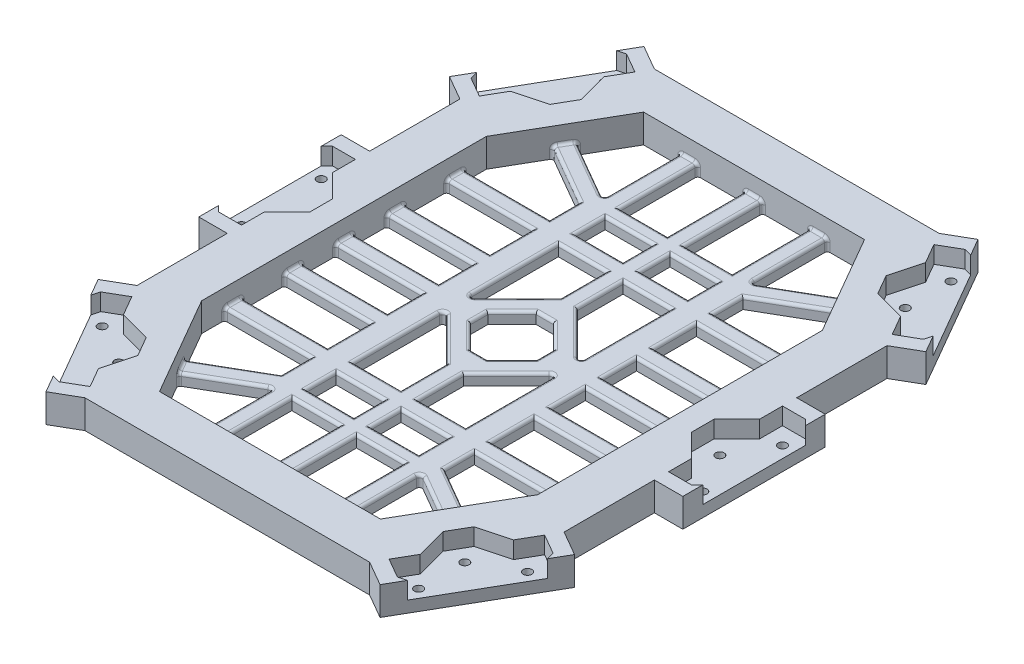
from build123d import *

# Parameters (mm, degrees)
EXTRUDE_1_DEPTH     = 10
SKETCH_2_W          = 20
SKETCH_2_H          = 50.000000000000014
SKETCH_2_W_2        = 20.000000000000014
SKETCH_2_H_2        = 49.999999999999986
EXTRUDE_2_DEPTH     = 10
CUT_EXTRUDE_1_DEPTH = 6
CUT_EXTRUDE_2_DEPTH = 6
CUT_EXTRUDE_3_DEPTH = 4
FILLET_1_R          = 1
SKETCH_6_R          = 1.4999999999999971
SKETCH_6_R_2        = 1.4999999999999973
SKETCH_6_R_3        = 1.5000000000000042
CUT_EXTRUDE_4_DEPTH = 136.2257371952552


with BuildPart() as part:
    # 草图1 → 凸台-拉伸1 (new body)
    with BuildSketch(Plane(origin=(0, 0, 0), x_dir=(1, 0, 0), z_dir=(0, 1, 0))):
        Polygon((-74.99999999999993, -56.6987298107775), (-49.999999999999915, -100), (50, -100.00000000000001), (75, -56.69872981077748), (75, 56.698729810777465), (49.99999999999999, 99.99999999999999), (-49.999999999999915, 99.99999999999999), (-74.99999999999991, 56.6987298107775), align=None)
    extrude(amount=EXTRUDE_1_DEPTH)

    # 草图2 → 凸台-拉伸2 (add)
    with BuildSketch(Plane(origin=(0, 10, 0), x_dir=(1, 0, 0), z_dir=(0, 1, 0))):
        with Locations((74.99999999999999, 1.78e-15)):
            Rectangle(SKETCH_2_W, SKETCH_2_H)
        Polygon((50.00000000000012, 99.99999999999976), (74.99999999999986, 56.698729810777685), (83.66025403784657, 61.698729810778985), (58.66025403784683, 105.00000000000107), align=None)
        Polygon((-74.99999999999983, 56.69872981077767), (-83.66025403784452, 61.69872981077777), (-58.660254037844794, 104.99999999999984), (-50.00000000000012, 99.99999999999974), align=None)
        Polygon((74.99999999999984, -56.69872981077769), (83.66025403784478, -61.69872981077793), (58.66025403784505, -105), (50.00000000000012, -99.99999999999976), align=None)
        Polygon((-74.99999999999983, -56.69872981077767), (-83.66025403784452, -61.69872981077777), (-58.660254037844794, -104.99999999999984), (-50.00000000000012, -99.99999999999974), align=None)
        with Locations((-74.99999999999997, -1.066e-14)):
            Rectangle(SKETCH_2_W_2, SKETCH_2_H_2)
    extrude(amount=-EXTRUDE_2_DEPTH)

    # 草图3 → 切除-拉伸1 (cut)
    with BuildSketch(Plane(origin=(0, 10, 0), x_dir=(1, 0, 0), z_dir=(0, 1, 0))):
        Polygon((67.00000000000001, 4), (67.00000000000001, 0), (67.00000000000001, -4), (75.00000000000001, -12), (75.00000000000001, -20), (83.00000000000001, -20), (88.00000000000003, -15), (88.00000000000003, 15), (83.00000000000001, 20), (75.00000000000001, 20), (75.00000000000001, 12), align=None)
        Polygon((-67.00000000000001, -4), (-74.99999999999999, -12), (-74.99999999999999, -20), (-82.99999999999999, -20), (-88, -15), (-88, 14.999999999999972), (-82.99999999999999, 19.99999999999997), (-74.99999999999999, 19.99999999999997), (-74.99999999999999, 11.999999999999973), (-67.00000000000001, 4), (-67.00000000000001, 0), align=None)
        Polygon((53.57179676972452, 77.81346652052642), (55.57179676972452, 74.34936490538865), (57.571796769724514, 70.88526329025092), (68.50000000000001, 67.95706005997543), (72.50000000000004, 61.02885682969991), (79.42820323027556, 65.02885682969992), (81.25833024919774, 71.85898384862213), (66.25833024919773, 97.83974596215525), (59.428203230275486, 99.66987298107745), (52.49999999999999, 95.66987298107745), (56.500000000000014, 88.74166975080192), align=None)
        Polygon((-53.57179676972451, 77.8134665205264), (-56.5, 88.7416697508019), (-52.49999999999998, 95.66987298107743), (-59.42820323027547, 99.66987298107743), (-66.25833024919773, 97.83974596215523), (-81.25833024919771, 71.85898384862212), (-79.42820323027553, 65.02885682969989), (-72.50000000000001, 61.02885682969988), (-68.49999999999999, 67.9570600599754), (-57.5717967697245, 70.8852632902509), (-55.57179676972451, 74.34936490538864), align=None)
        Polygon((53.57179676972452, -77.81346652052642), (56.500000000000014, -88.74166975080192), (52.49999999999999, -95.66987298107745), (59.428203230275486, -99.66987298107745), (66.25833024919773, -97.83974596215525), (81.25833024919774, -71.85898384862213), (79.42820323027556, -65.02885682969992), (72.50000000000004, -61.02885682969991), (68.50000000000001, -67.95706005997543), (57.571796769724514, -70.88526329025092), (55.57179676972452, -74.34936490538865), align=None)
        Polygon((-53.57179676972451, -77.8134665205264), (-55.57179676972451, -74.34936490538864), (-57.5717967697245, -70.8852632902509), (-68.49999999999999, -67.9570600599754), (-72.50000000000001, -61.02885682969988), (-79.42820323027553, -65.02885682969989), (-81.25833024919771, -71.85898384862212), (-66.25833024919773, -97.83974596215523), (-59.42820323027547, -99.66987298107743), (-52.49999999999998, -95.66987298107743), (-56.5, -88.7416697508019), align=None)
    extrude(amount=-CUT_EXTRUDE_1_DEPTH, mode=Mode.SUBTRACT)

    # 草图4 → 切除-拉伸2 (cut)
    with BuildSketch(Plane(origin=(0, 10, 0), x_dir=(1, 0, 0), z_dir=(0, 1, 0))):
        Polygon((59, 49.99999999999999), (59.00000000000002, -49.99999999999999), (38.792740578363116, -84.99999999999999), (-38.792740578362974, -84.99999999999999), (-58.999999999999886, -49.99999999999999), (-59, 49.99999999999999), (-38.79274057836309, 84.99999999999999), (38.79274057836309, 84.99999999999999), align=None)
    extrude(amount=-CUT_EXTRUDE_2_DEPTH, mode=Mode.SUBTRACT)

    # 草图5 → 切除-拉伸3 (cut)
    with BuildSketch(Plane(origin=(0, 4, 0), x_dir=(1, 0, 0), z_dir=(0, 1, 0))):
        Polygon((-25.745735194570564, 57.59807621135331), (-25.74573519457057, 84.99999999999999), (-38.79274057836309, 84.99999999999999), (-47.39637028918155, 70.0980762113533), align=None)
        Polygon((-2.999999999999993, 57.598076211353316), (-2.9999999999999956, 84.99999999999999), (-19.745735194570564, 84.99999999999999), (-19.74573519457056, 57.598076211353316), align=None)
        Polygon((3.000000000000007, 57.598076211353316), (19.745735194570575, 57.598076211353316), (19.745735194570575, 84.99999999999999), (3, 84.99999999999999), align=None)
        Polygon((25.745735194570578, 57.59807621135331), (47.39637028918153, 70.0980762113533), (38.79274057836309, 84.99999999999999), (25.745735194570578, 84.99999999999999), align=None)
        Polygon((59, 49.99999999999999), (50.39637028918155, 64.90192378864667), (28.74573519457059, 52.401923788646656), (28.74573519457059, 41.99999999999998), (59.00000000000002, 41.999999999999986), align=None)
        Polygon((-28.745735194570575, 41.99999999999998), (-28.745735194570578, 52.40192378864664), (-50.39637028918152, 64.90192378864664), (-59, 49.99999999999999), (-58.99999999999999, 41.999999999999964), align=None)
        Polygon((-2.999999999999991, 41.99999999999998), (-2.9999999999999925, 52.49999999999999), (-19.74573519457056, 52.43620853116844), (-19.745735194570557, 41.99999999999998), align=None)
        Polygon((19.745735194570578, 41.99999999999998), (19.745735194570575, 52.43620853116845), (3.000000000000007, 52.49999999999999), (3.0000000000000084, 41.99999999999998), align=None)
        Polygon((-28.745735194570575, 20.999999999999993), (-28.74573519457057, 35.99999999999999), (-59.000000000000014, 35.99999999999997), (-58.999999999999964, 20.999999999999968), align=None)
        Polygon((-59, 2.999999999999975), (-28.745735194570564, 2.999999999999994), (-28.745735194570575, 14.999999999999996), (-59, 14.999999999999972), align=None)
        Polygon((-28.745735194570564, -2.999999999999994), (-59, -2.999999999999975), (-58.99999999999993, -14.999999999999979), (-28.745735194570575, -14.999999999999996), align=None)
        Polygon((-2.999999999999989, 19.999999999999986), (-2.9999999999999907, 35.99999999999999), (-19.745735194570557, 35.99999999999999), (-19.745735194570553, 3.254264805429365), align=None)
        Polygon((19.74573519457058, 3.254264805429365), (19.745735194570578, 35.99999999999999), (3.0000000000000107, 35.99999999999999), (3.0000000000000115, 19.999999999999986), align=None)
        Polygon((59.00000000000002, 36), (28.74573519457059, 35.99999999999999), (28.745735194570592, 20.999999999999993), (59.00000000000002, 20.999999999999993), align=None)
        Polygon((-2.999999999999988, -11.514718625761407), (-11.514718625761352, -3), (-11.514718625761352, 3), (-2.999999999999988, 11.514718625761407), (3.000000000000012, 11.514718625761407), (11.51471862576138, 3), (11.51471862576138, -3), (3.000000000000012, -11.514718625761407), align=None)
        Polygon((59.00000000000002, 15), (28.745735194570592, 14.999999999999996), (28.74573519457059, 3), (59.000000000000014, 3.0000000000000027), align=None)
        Polygon((59.000000000000014, -15), (59.000000000000014, -3), (28.74573519457059, -3), (28.745735194570592, -14.999999999999996), align=None)
        Polygon((59.00000000000002, -36), (59.000000000000014, -20.999999999999993), (28.745735194570592, -20.999999999999993), (28.74573519457059, -35.99999999999999), align=None)
        Polygon((-28.745735194570575, -20.999999999999993), (-59, -20.999999999999968), (-58.9999999999999, -35.99999999999998), (-28.74573519457057, -35.99999999999999), align=None)
        Polygon((-2.999999999999989, -19.99999999999999), (-19.745735194570557, -3.2542648054293686), (-19.745735194570557, -35.99999999999999), (-2.999999999999993, -35.99999999999999), align=None)
        Polygon((19.745735194570578, -35.99999999999999), (19.74573519457058, -3.254264805429365), (3.0000000000000115, -19.99999999999999), (3.0000000000000093, -35.99999999999999), align=None)
        Polygon((59.00000000000002, -49.99999999999999), (59.00000000000002, -41.999999999999986), (28.74573519457059, -41.99999999999998), (28.74573519457059, -52.401923788646656), (50.39637028918153, -64.90192378864666), align=None)
        Polygon((19.745735194570575, -52.43620853116845), (19.745735194570578, -41.99999999999998), (3.0000000000000107, -41.99999999999998), (3.000000000000007, -52.49999999999999), align=None)
        Polygon((19.745735194570575, -84.99999999999999), (19.745735194570575, -57.598076211353316), (3.000000000000007, -57.598076211353316), (3.0000000000000027, -84.99999999999999), align=None)
        Polygon((47.39637028918153, -70.0980762113533), (25.745735194570578, -57.59807621135331), (25.745735194570578, -84.99999999999999), (38.792740578363116, -84.99999999999999), align=None)
        Polygon((-19.745735194570567, -84.99999999999999), (-2.999999999999993, -84.99999999999999), (-2.999999999999993, -57.598076211353316), (-19.74573519457056, -57.598076211353316), align=None)
        Polygon((-2.999999999999993, -41.99999999999998), (-19.745735194570557, -41.99999999999998), (-19.74573519457056, -52.43620853116844), (-2.9999999999999964, -52.49999999999999), align=None)
        Polygon((-28.745735194570578, -41.99999999999998), (-59.000000000000014, -41.999999999999964), (-58.999999999999886, -49.99999999999999), (-50.39637028918147, -64.90192378864661), (-28.745735194570578, -52.40192378864664), align=None)
        Polygon((-38.792740578362974, -84.99999999999999), (-25.74573519457057, -84.99999999999999), (-25.745735194570564, -57.59807621135331), (-47.39637028918152, -70.09807621135329), align=None)
    extrude(amount=-CUT_EXTRUDE_3_DEPTH, mode=Mode.SUBTRACT)

    # 圆角1
    fillet_1_edges = [part.edges().sort_by_distance(p)[0] for p in [
        (48.89637028918155, 4, -67.49999999999999),
        (22.745735194570578, 4, -84.99999999999999),
        (7.11e-15, 4, -84.99999999999999),
        (-22.745735194570564, 4, -84.99999999999999),
        (-48.89637028918155, 4, -67.49999999999999),
        (-58.999999999999986, 4, -38.99999999999998),
        (-58.999999999999964, 4, -17.99999999999998),
        (-58.99999999999994, 4, 0),
        (-58.99999999999992, 4, 17.99999999999997),
        (-58.9999999999999, 4, 38.99999999999997),
        (-48.89637028918146, 4, 67.49999999999993),
        (-22.745735194570564, 4, 84.99999999999999),
        (7.11e-15, 4, 84.99999999999999),
        (22.745735194570578, 4, 84.99999999999999),
        (48.89637028918156, 4, 67.5),
        (59.00000000000002, 4, 38.99999999999999),
        (59.000000000000014, 4, 18.000000000000007),
        (59.000000000000014, 4, 0),
        (59.00000000000001, 4, -18),
        (59, 4, -38.99999999999999),
        (-28.745735194570567, 4, -8.999999999999998),
        (-43.87286759728528, 4, -2.9999999999999845),
        (-58.99999999999997, 2, -2.999999999999977),
        (-43.872867597285286, 4, -14.999999999999984),
        (-58.99999999999998, 2, -14.999999999999972),
        (-58.999999999999964, 2, 14.999999999999975),
        (-58.99999999999997, 2, 2.999999999999977),
        (-28.74573519457057, 4, 8.999999999999998),
        (-43.87286759728528, 4, 2.9999999999999845),
        (-43.872867597285286, 4, 14.999999999999984),
        (-11.372867597285273, 4, -11.627132402714679),
        (-19.745735194570557, 2, -3.254264805429367),
        (-11.372867597285275, 4, -35.99999999999999),
        (-2.99999999999999, 4, -27.99999999999999),
        (-19.745735194570557, 4, -19.62713240271468),
        (19.745735194570578, 4, -19.62713240271468),
        (19.74573519457058, 2, -3.254264805429365),
        (11.372867597285294, 4, -35.99999999999999),
        (3.0000000000000107, 4, -27.99999999999999),
        (11.372867597285296, 4, -11.627132402714677),
        (43.8728675972853, 4, 3.0000000000000013),
        (59.000000000000014, 2, 3.0000000000000013),
        (43.87286759728531, 4, 14.999999999999998),
        (59.000000000000014, 2, 15),
        (28.745735194570592, 4, 8.999999999999998),
        (59.000000000000014, 2, -15.000000000000004),
        (59.000000000000014, 2, -3.0000000000000013),
        (43.87286759728531, 4, -14.999999999999998),
        (28.745735194570592, 4, -8.999999999999998),
        (43.8728675972853, 4, -3.0000000000000013),
        (-7.25735931288067, 4, 7.257359312880704),
        (1.199e-14, 4, -11.514718625761407),
        (7.257359312880697, 4, -7.257359312880704),
        (11.51471862576138, 4, 0),
        (1.199e-14, 4, 11.514718625761407),
        (7.257359312880697, 4, 7.257359312880704),
        (-7.25735931288067, 4, -7.257359312880704),
        (-11.514718625761352, 4, 0),
        (43.87286759728531, 4, -36),
        (59.000000000000014, 2, -36),
        (59.000000000000014, 2, -20.999999999999993),
        (28.745735194570592, 4, -28.499999999999993),
        (43.87286759728531, 4, -20.999999999999993),
        (-19.745735194570564, 4, -71.29903810567666),
        (-19.745735194570564, 2, -84.99999999999999),
        (-2.9999999999999942, 4, -71.29903810567666),
        (-2.9999999999999942, 2, -84.99999999999999),
        (-11.372867597285277, 4, -57.598076211353316),
        (11.37286759728529, 4, -57.598076211353316),
        (3.0000000000000013, 2, -84.99999999999999),
        (19.745735194570575, 2, -84.99999999999999),
        (19.745735194570575, 4, -71.29903810567666),
        (3.0000000000000044, 4, -71.29903810567666),
        (43.87286759728531, 4, -41.999999999999986),
        (59.000000000000014, 2, -41.999999999999986),
        (50.39637028918154, 2, -64.90192378864666),
        (39.57105274187606, 4, -58.651923788646656),
        (28.74573519457059, 4, -47.200961894323314),
        (25.745735194570578, 4, -71.29903810567664),
        (25.745735194570578, 2, -57.59807621135331),
        (25.745735194570578, 2, -84.99999999999999),
        (36.57105274187606, 4, -63.8480762113533),
        (47.39637028918153, 2, -70.09807621135332),
        (-28.74573519457057, 4, -28.499999999999993),
        (-43.872867597285286, 4, -20.99999999999998),
        (-58.999999999999986, 2, -20.999999999999968),
        (-59, 2, -35.99999999999997),
        (-43.87286759728529, 4, -35.999999999999986),
        (11.372867597285294, 4, -41.99999999999998),
        (19.745735194570578, 4, -47.218104265584216),
        (11.37286759728529, 4, -52.468104265584216),
        (3.000000000000008, 4, -47.249999999999986),
        (-11.372867597285278, 4, -52.468104265584216),
        (-2.999999999999992, 4, -47.249999999999986),
        (-19.745735194570557, 4, -47.21810426558421),
        (-11.372867597285275, 4, -41.99999999999998),
        (-39.571052741876045, 4, -58.65192378864664),
        (-50.39637028918153, 2, -64.90192378864666),
        (-28.745735194570575, 4, -47.200961894323314),
        (-59, 2, -41.999999999999964),
        (-43.87286759728529, 4, -41.99999999999997),
        (-43.87286759728529, 4, 41.99999999999997),
        (-58.99999999999996, 2, 41.999999999999964),
        (-50.39637028918149, 2, 64.90192378864663),
        (-39.571052741876045, 4, 58.65192378864664),
        (-28.745735194570578, 4, 47.200961894323314),
        (-25.745735194570567, 4, 71.29903810567664),
        (-25.745735194570564, 2, 57.59807621135331),
        (-25.74573519457057, 2, 84.99999999999999),
        (-36.571052741876045, 4, 63.8480762113533),
        (-47.39637028918149, 2, 70.09807621135327),
        (-19.745735194570557, 4, 47.21810426558421),
        (-11.372867597285275, 4, 41.99999999999998),
        (-11.372867597285278, 4, 52.468104265584216),
        (-2.999999999999992, 4, 47.249999999999986),
        (-2.9999999999999942, 2, 84.99999999999999),
        (-19.745735194570567, 2, 84.99999999999999),
        (-11.372867597285277, 4, 57.598076211353316),
        (-2.9999999999999942, 4, 71.29903810567666),
        (-19.745735194570564, 4, 71.29903810567666),
        (39.57105274187606, 4, 58.651923788646656),
        (50.39637028918155, 2, 64.90192378864666),
        (28.74573519457059, 4, 47.200961894323314),
        (59.00000000000002, 2, 41.999999999999986),
        (43.87286759728531, 4, 41.999999999999986),
        (3.000000000000008, 4, 47.249999999999986),
        (11.37286759728529, 4, 52.468104265584216),
        (19.745735194570578, 4, 47.218104265584216),
        (11.372867597285294, 4, 41.99999999999998),
        (19.745735194570575, 4, 71.29903810567666),
        (19.745735194570578, 2, 84.99999999999999),
        (3.0000000000000044, 4, 71.29903810567666),
        (3.0000000000000013, 2, 84.99999999999999),
        (11.37286759728529, 4, 57.598076211353316),
        (47.39637028918155, 2, 70.09807621135332),
        (25.745735194570578, 2, 84.99999999999999),
        (25.745735194570578, 2, 57.59807621135331),
        (36.57105274187606, 4, 63.8480762113533),
        (25.745735194570578, 4, 71.29903810567664),
        (28.745735194570592, 4, 28.499999999999993),
        (43.87286759728531, 4, 20.999999999999993),
        (59.000000000000014, 2, 20.999999999999993),
        (59.00000000000002, 2, 36),
        (43.87286759728531, 4, 36),
        (-43.87286759728529, 4, 35.999999999999986),
        (-58.99999999999996, 2, 35.99999999999997),
        (-58.99999999999996, 2, 20.999999999999964),
        (-28.74573519457057, 4, 28.499999999999993),
        (-43.872867597285286, 4, 20.99999999999998),
        (-19.745735194570557, 4, 19.62713240271468),
        (-19.745735194570557, 2, 3.254264805429367),
        (-11.372867597285275, 4, 35.99999999999999),
        (-2.99999999999999, 4, 27.99999999999999),
        (-11.372867597285273, 4, 11.627132402714679),
        (3.0000000000000107, 4, 27.99999999999999),
        (11.372867597285296, 4, 11.627132402714677),
        (19.74573519457058, 2, 3.254264805429365),
        (11.372867597285294, 4, 35.99999999999999),
        (19.745735194570578, 4, 19.62713240271468),
        (-47.39637028918153, 2, -70.09807621135329),
        (-25.745735194570567, 2, -84.99999999999999),
        (-25.745735194570564, 2, -57.59807621135331),
        (-36.571052741876045, 4, -63.8480762113533),
        (-25.745735194570567, 4, -71.29903810567664),
    ]]
    fillet(fillet_1_edges, radius=FILLET_1_R)

    # 草图6 → 切除-拉伸4 (cut, through all)
    with BuildSketch(Plane(origin=(0, 4, 0), x_dir=(1, 0, 0), z_dir=(0, 1, 0))):
        with Locations(Location((73.00000000000001, 0, 0), (0, 0, 270))):
            Circle(SKETCH_6_R)
        with Locations(Location((81.00000000000001, 14, 0), (0, 0, 270))):
            Circle(SKETCH_6_R_2)
        with Locations(Location((81.00000000000001, -14, 0), (0, 0, 270))):
            Circle(SKETCH_6_R_2)
        with Locations(Location((60.7679491924312, 77.34936490538855, 0), (0, 0, 270))):
            Circle(SKETCH_6_R_2)
        with Locations(Location((60.69615242270666, 93.47372055837086, 0), (0, 0, 270))):
            Circle(SKETCH_6_R_3)
        with Locations(Location((74.69615242270683, 69.22500925240628, 0), (0, 0, 270))):
            Circle(SKETCH_6_R_2)
        with Locations(Location((-80.99999999999999, -14.000000000000028, 0), (0, 0, 90))):
            Circle(SKETCH_6_R_2)
        with Locations(Location((-72.99999999999999, -1.788e-14, 0), (0, 0, 90))):
            Circle(SKETCH_6_R)
        with Locations(Location((-80.99999999999999, 13.999999999999973, 0), (0, 0, 90))):
            Circle(SKETCH_6_R_2)
        with Locations(Location((-74.69615242270683, 69.22500925240627, 0), (0, 0, 90))):
            Circle(SKETCH_6_R_2)
        with Locations(Location((-60.76794919243119, 77.34936490538854, 0), (0, 0, 90))):
            Circle(SKETCH_6_R_2)
        with Locations(Location((-60.69615242270666, 93.47372055837084, 0), (0, 0, 90))):
            Circle(SKETCH_6_R_3)
        with Locations(Location((-74.69615242270683, -69.22500925240627, 0), (0, 0, 270))):
            Circle(SKETCH_6_R_2)
        with Locations(Location((-60.76794919243119, -77.34936490538854, 0), (0, 0, 270))):
            Circle(SKETCH_6_R_2)
        with Locations(Location((-60.69615242270666, -93.47372055837084, 0), (0, 0, 270))):
            Circle(SKETCH_6_R_3)
        with Locations(Location((74.69615242270683, -69.22500925240628, 0), (0, 0, 90))):
            Circle(SKETCH_6_R_2)
        with Locations(Location((60.7679491924312, -77.34936490538855, 0), (0, 0, 90))):
            Circle(SKETCH_6_R_2)
        with Locations(Location((60.69615242270666, -93.47372055837086, 0), (0, 0, 90))):
            Circle(SKETCH_6_R_3)
    extrude(amount=-CUT_EXTRUDE_4_DEPTH, mode=Mode.SUBTRACT)


solid = part.part
